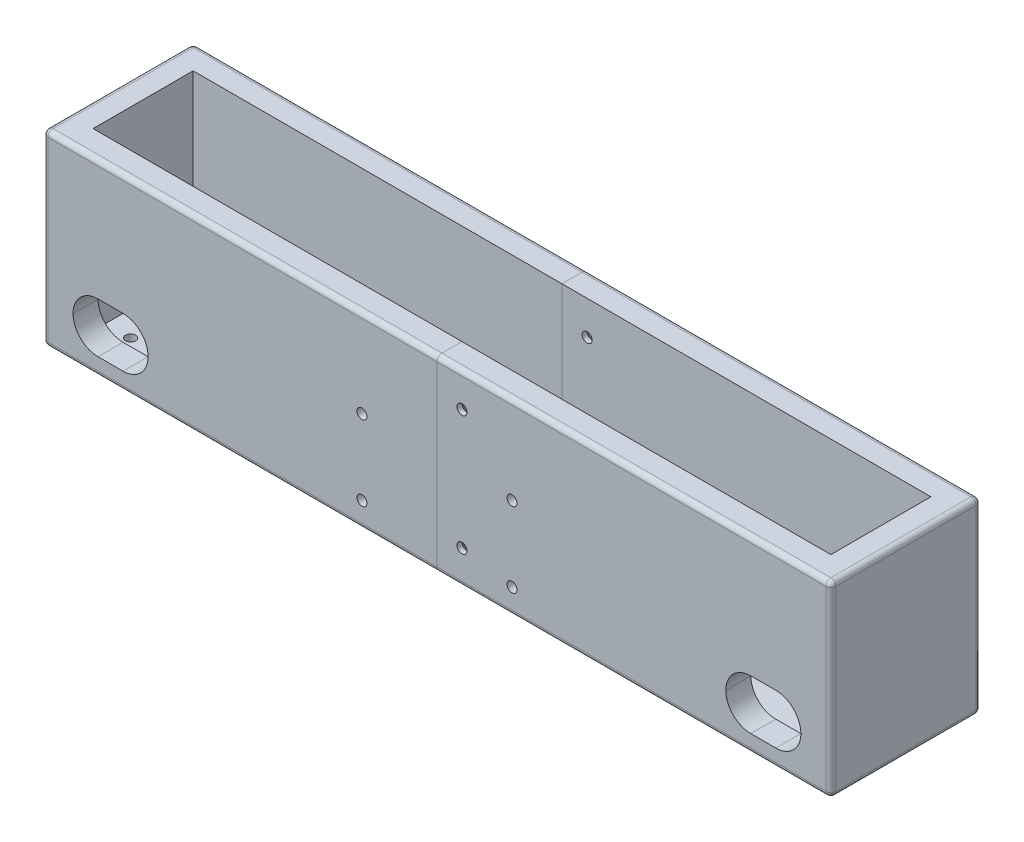
from build123d import *

# Parameters (mm, degrees)
SKETCH1_W           = 315
SKETCH1_H           = 60
BOSS_EXTRUDE1_DEPTH = 75
SKETCH2_W           = 295
SKETCH2_H           = 40
CUT_EXTRUDE1_DEPTH  = 70
FILLET1_R           = 2
FILLET2_R           = 2
SKETCH4_R           = 2
CUT_EXTRUDE3_DEPTH  = 70
SKETCH5_W           = 6
SKETCH5_H           = 71
CUT_EXTRUDE4_DEPTH  = 20
SKETCH6_W           = 5.2
SKETCH6_H           = 70.2
BOSS_EXTRUDE2_DEPTH = 20
SKETCH7_R           = 2
CUT_EXTRUDE5_DEPTH  = 77
SKETCH8_R           = 2
CUT_EXTRUDE6_DEPTH  = 175.946420369
SKETCH11_R          = 2
CUT_EXTRUDE7_DEPTH  = 10
SKETCH13_W          = 30
SKETCH13_H          = 20
CUT_EXTRUDE9_DEPTH  = 10
FILLET4_R           = 10
FILLET5_R           = 10


with BuildPart() as part:
    # Sketch1 → Boss-Extrude1 (new body)
    with BuildSketch(Plane(origin=(0, 0, 0), x_dir=(1, 0, 0), z_dir=(0, 1, 0))):
        Rectangle(SKETCH1_W, SKETCH1_H)
    extrude(amount=BOSS_EXTRUDE1_DEPTH)

    # Sketch2 → Cut-Extrude1 (cut)
    with BuildSketch(Plane(origin=(0, 75, 0), x_dir=(1, 0, 0), z_dir=(0, 1, 0))):
        Rectangle(SKETCH2_W, SKETCH2_H)
    extrude(amount=-CUT_EXTRUDE1_DEPTH, mode=Mode.SUBTRACT)

    # Fillet1
    fillet1_edges = [part.edges().sort_by_distance(p)[0] for p in [
        (157.5, 75, 0),
        (-157.5, 75, 0),
        (157.5, 0, 0),
        (-157.5, 0, 0),
    ]]
    fillet(fillet1_edges, radius=FILLET1_R)

    # Fillet2
    fillet2_edges = [part.edges().sort_by_distance(p)[0] for p in [
        (157.5, 37.5, -30),
        (157.5, 37.5, 30),
        (0, 0, -30),
        (-157.5, 37.5, -30),
        (0, 75, -30),
        (-156.914213562, 74.414213562, -30),
        (-156.914213562, 0.585786438, -30),
        (156.914213562, 74.414213562, -30),
        (156.914213562, 0.585786438, -30),
        (0, 0, 30),
        (0, 75, 30),
        (-157.5, 37.5, 30),
        (-156.914213562, 74.414213562, 30),
        (-156.914213562, 0.585786438, 30),
        (156.914213562, 74.414213562, 30),
        (156.914213562, 0.585786438, 30),
    ]]
    fillet(fillet2_edges, radius=FILLET2_R)


with BuildPart() as body_2:
    # Split1: the piece on the far side of the plane
    add(part.part)
    split(bisect_by=Plane(origin=(0, 0, 0), x_dir=(0, 0, 1), z_dir=(1, 0, 0)), keep=Keep.BOTTOM)

    # Sketch6 → Boss-Extrude2 (add)
    with BuildSketch(Plane(origin=(0, 0, 0), x_dir=(0, 0, -1), z_dir=(1, 0, 0))):
        with Locations((-25, 37.5)):
            Rectangle(SKETCH6_W, SKETCH6_H)
        with Locations((25, 37.5)):
            Rectangle(SKETCH6_W, SKETCH6_H)
    extrude(amount=BOSS_EXTRUDE2_DEPTH)

    # Sketch7 → Cut-Extrude5 (cut)
    with BuildSketch(Plane.XY.offset(27.6)):
        with Locations((10, 61.5)):
            Circle(SKETCH7_R)
        with Locations((10, 13.5)):
            Circle(SKETCH7_R)
    extrude(amount=-CUT_EXTRUDE5_DEPTH, mode=Mode.SUBTRACT)


with BuildPart() as part_1:
    add(part.part)

    # Split1
    split(bisect_by=Plane(origin=(0, 0, 0), x_dir=(0, 0, 1), z_dir=(1, 0, 0)), keep=Keep.TOP)

    # Sketch4 → Cut-Extrude3 (cut)
    with BuildSketch(Plane.XY.offset(30)):
        with Locations((10, 61.5)):
            Circle(SKETCH4_R)
        with Locations((10, 13.5)):
            Circle(SKETCH4_R)
    extrude(amount=-CUT_EXTRUDE3_DEPTH, mode=Mode.SUBTRACT)

    # Sketch5 → Cut-Extrude4 (cut)
    with BuildSketch(Plane.ZY):
        with Locations((-25, 37.5)):
            Rectangle(SKETCH5_W, SKETCH5_H)
        with Locations((25, 37.5)):
            Rectangle(SKETCH5_W, SKETCH5_H)
    extrude(amount=-CUT_EXTRUDE4_DEPTH, mode=Mode.SUBTRACT)


with BuildPart() as cut_extrude6_tool:
    # Sketch8 → Cut-Extrude6 (new, through all)
    with BuildSketch(Plane(origin=(0, 5, 0), x_dir=(1, 0, 0), z_dir=(0, 1, 0))):
        with Locations(Location((137.5, 15, 0), (0, 0, 270))):
            Circle(SKETCH8_R)
        with Locations(Location((137.5, -15, 0), (0, 0, 90))):
            Circle(SKETCH8_R)
        with Locations(Location((-137.5, -15, 0), (0, 0, 270))):
            Circle(SKETCH8_R)
        with Locations(Location((-137.5, 15, 0), (0, 0, 90))):
            Circle(SKETCH8_R)
    extrude(amount=-CUT_EXTRUDE6_DEPTH)


with BuildPart() as part_2:
    add(part_1.part)

    # Cut-Extrude6: cut by cut_extrude6_tool
    add(cut_extrude6_tool.part, mode=Mode.SUBTRACT)


with BuildPart() as body_2_1:
    add(body_2.part)

    # Cut-Extrude6: cut by cut_extrude6_tool
    add(cut_extrude6_tool.part, mode=Mode.SUBTRACT)


with BuildPart() as cut_extrude7_tool:
    # Sketch11 → Cut-Extrude7 (new body)
    with BuildSketch(Plane.XY.offset(30)):
        with Locations((-30, 10)):
            Circle(SKETCH11_R)
        with Locations((-30, 40)):
            Circle(SKETCH11_R)
        with Locations(Location((30, 10, 0), (0, 0, 180))):
            Circle(SKETCH11_R)
        with Locations(Location((30, 40, 0), (0, 0, 180))):
            Circle(SKETCH11_R)
    extrude(amount=-CUT_EXTRUDE7_DEPTH)


with BuildPart() as part_3:
    add(part_2.part)

    # Cut-Extrude7: cut by cut_extrude7_tool
    add(cut_extrude7_tool.part, mode=Mode.SUBTRACT)


with BuildPart() as body_2_2:
    add(body_2_1.part)

    # Cut-Extrude7: cut by cut_extrude7_tool
    add(cut_extrude7_tool.part, mode=Mode.SUBTRACT)


with BuildPart() as cut_extrude9_tool:
    # Sketch13 → Cut-Extrude9 (new body)
    with BuildSketch(Plane.XY.offset(30)):
        with Locations((130.5, 17)):
            Rectangle(SKETCH13_W, SKETCH13_H)
        with Locations((-130.5, 17)):
            Rectangle(SKETCH13_W, SKETCH13_H)
    extrude(amount=-CUT_EXTRUDE9_DEPTH)


with BuildPart() as part_4:
    add(part_3.part)

    # Cut-Extrude9: cut by cut_extrude9_tool
    add(cut_extrude9_tool.part, mode=Mode.SUBTRACT)

    # Fillet5
    fillet5_edges = [part_4.edges().sort_by_distance(p)[0] for p in [
        (145.5, 27, 25),
        (115.5, 7, 25),
        (145.5, 7, 25),
        (115.5, 27, 25),
    ]]
    fillet(fillet5_edges, radius=FILLET5_R - 0.0001)  # a hair under: the kernel refuses the full size


with BuildPart() as body_2_3:
    add(body_2_2.part)

    # Cut-Extrude9: cut by cut_extrude9_tool
    add(cut_extrude9_tool.part, mode=Mode.SUBTRACT)

    # Fillet4
    fillet4_edges = [body_2_3.edges().sort_by_distance(p)[0] for p in [
        (-115.5, 7, 25),
        (-115.5, 27, 25),
        (-145.5, 27, 25),
        (-145.5, 7, 25),
    ]]
    fillet(fillet4_edges, radius=FILLET4_R - 0.0001)  # a hair under: the kernel refuses the full size


solid = Compound([part_4.part, body_2_3.part])
